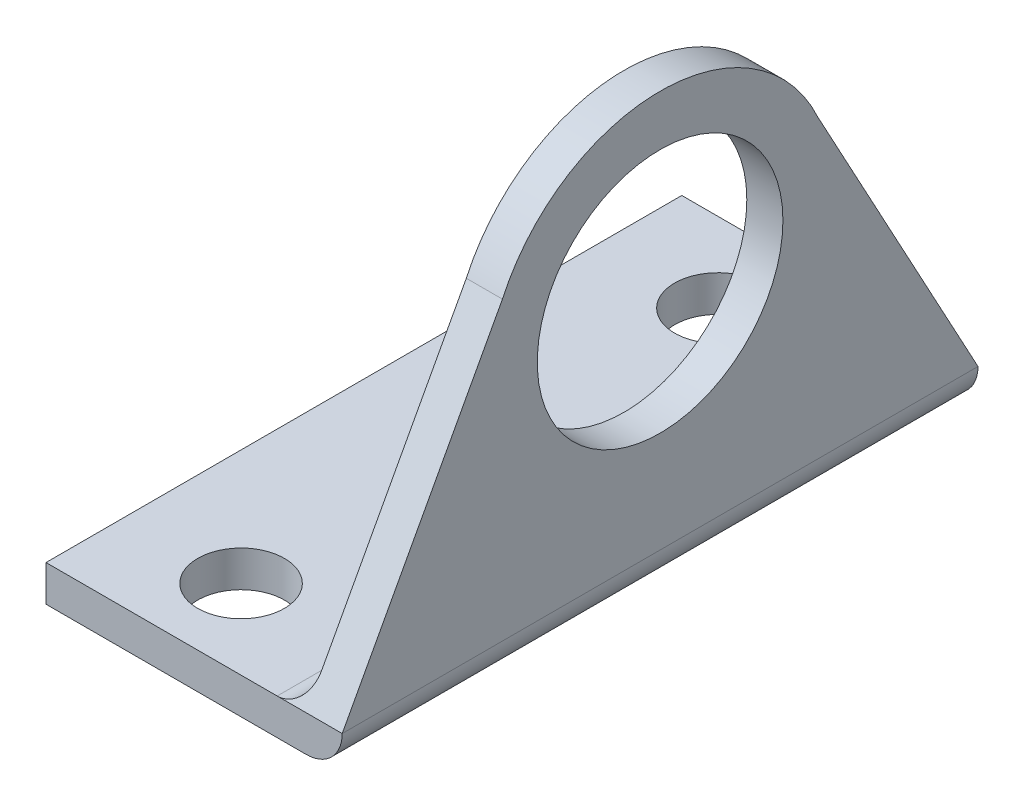
from build123d import *

# Parameters (mm, degrees)
SKETCH1_W              = 18
SKETCH1_H              = 44
BOSS_EXTRUDE1_DEPTH    = 2.5
SKETCH2_R              = 3
CUT_EXTRUDE1_DEPTH     = 2.5
SKETCH3_W              = 44
SKETCH3_H              = 30
BOSS_EXTRUDE2_DEPTH    = 2.5
CUT_EXTRUDE2_START     = -2.5
CUT_EXTRUDE2_OUTLINE_R = 8.5
CUT_EXTRUDE2_DEPTH     = 2.5
FILLET7_R              = 2.5
FILLET8_R              = 2


# Read off the part's stored shape, not the designer's step: Cut-Extrude2
with BuildPart() as part:
    # Sketch1 → Boss-Extrude1 (new body)
    with BuildSketch(Plane(origin=(0, 0, 0), x_dir=(1, 0, 0), z_dir=(0, 1, 0))):
        Rectangle(SKETCH1_W, SKETCH1_H)
    extrude(amount=BOSS_EXTRUDE1_DEPTH)

    # Sketch2 → Cut-Extrude1 (cut)
    with BuildSketch(Plane(origin=(0, 2.5, 0), x_dir=(1, 0, 0), z_dir=(0, 1, 0))):
        with Locations(Location((-1, -16.5, 0), (0, 0, 270))):
            Circle(SKETCH2_R)
        with Locations(Location((-1, 16.5, 0), (0, 0, 90))):
            Circle(SKETCH2_R)
    extrude(amount=-CUT_EXTRUDE1_DEPTH, mode=Mode.SUBTRACT)

    # Sketch3 → Boss-Extrude2 (add)
    with BuildSketch(Plane(origin=(9, 0, 0), x_dir=(0, 0, -1), z_dir=(1, 0, 0))):
        with Locations((0, 15)):
            Rectangle(SKETCH3_W, SKETCH3_H)
    extrude(amount=BOSS_EXTRUDE2_DEPTH)

    # Cut-Extrude2 outline → Cut-Extrude2 (cut)
    with BuildSketch(Plane(origin=(11.5, 0, 0), x_dir=(0, 0, -1), z_dir=(1, 0, 0)).offset(CUT_EXTRUDE2_START)):
        with BuildLine():
            ThreePointArc((-10.912541818, 22.991653356), (-6.484608549, 28.09703046), (0, 30.000007173))
            Line((0, 30.000007173), (-22, 30))
            Line((-22, 30), (-22, 2.5))
            Line((-22, 2.5), (-10.912541818, 22.991653356))
        make_face()
        with BuildLine():
            ThreePointArc((0, 30.000007173), (6.484608549, 28.09703046), (10.912541818, 22.991653356))
            Line((10.912541818, 22.991653356), (22, 2.5))
            Line((22, 2.5), (22, 30))
            Line((22, 30), (0, 30.000007173))
        make_face()
        with Locations((0, 18)):
            Circle(CUT_EXTRUDE2_OUTLINE_R)
    extrude(amount=CUT_EXTRUDE2_DEPTH, mode=Mode.SUBTRACT)

    # Fillet7
    fillet7_edges = [part.edges().sort_by_distance(p)[0] for p in [
        (11.5, 0, 0),
    ]]
    fillet(fillet7_edges, radius=FILLET7_R)

    # Fillet8
    fillet8_edges = [part.edges().sort_by_distance(p)[0] for p in [
        (9, 2.5, 0),
    ]]
    fillet(fillet8_edges, radius=FILLET8_R)


solid = part.part
